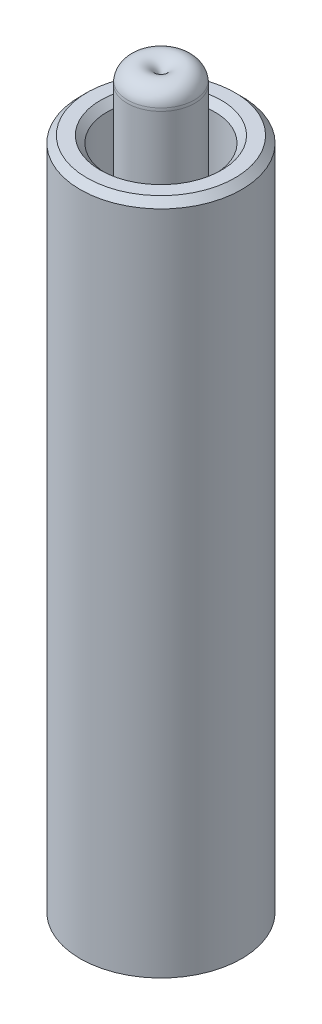
from build123d import *

# Parameters (mm, degrees)
SKETCH_1_R          = 6
EXTRUDE_1_DEPTH     = 50
SKETCH_2_R          = 4
SKETCH_2_R_2        = 2.5
CUT_EXTRUDE_1_DEPTH = 8
EXTRUDE_START       = 5
SKETCH_3_R          = 2.5
EXTRUDE_2_DEPTH     = 5
FILLET_1_R          = 1.7
SKETCH_4_R          = 0.096106959
CUT_EXTRUDE_2_DEPTH = 5
FILLET_2_R          = 1.2
CHAMFER_1_SIZE      = 0.5


with BuildPart() as part:
    # 草图1 → 凸台-拉伸1 (new body)
    with BuildSketch(Plane(origin=(0, 0, 0), x_dir=(1, 0, 0), z_dir=(0, 1, 0))):
        Circle(SKETCH_1_R)
    extrude(amount=EXTRUDE_1_DEPTH)

    # 草图2 → 切除-拉伸1 (cut)
    with BuildSketch(Plane(origin=(0, 50, 0), x_dir=(1, 0, 0), z_dir=(0, 1, 0))):
        Circle(SKETCH_2_R)
        Circle(SKETCH_2_R_2, mode=Mode.SUBTRACT)
    extrude(amount=-CUT_EXTRUDE_1_DEPTH, mode=Mode.SUBTRACT)

    # 草图3 → 凸台-拉伸2 (add)
    with BuildSketch(Plane(origin=(0, 50, 0), x_dir=(1, 0, 0), z_dir=(0, 1, 0)).offset(EXTRUDE_START)):
        Circle(SKETCH_3_R)
    extrude(amount=-EXTRUDE_2_DEPTH)

    # 圆角1
    fillet_1_edges = [part.edges().sort_by_distance(p)[0] for p in [
        (-2.5, 55, 0),
    ]]
    fillet(fillet_1_edges, radius=FILLET_1_R)

    # 草图4 → 切除-拉伸2 (cut)
    with BuildSketch(Plane(origin=(0, 55, 0), x_dir=(1, 0, 0), z_dir=(0, 1, 0))):
        Circle(SKETCH_4_R)
    extrude(amount=-CUT_EXTRUDE_2_DEPTH, mode=Mode.SUBTRACT)

    # 圆角2
    fillet_2_edges = [part.edges().sort_by_distance(p)[0] for p in [
        (-0.096106959, 55, 0),
    ]]
    fillet(fillet_2_edges, radius=FILLET_2_R)

    # 倒角1
    chamfer_1_edges = [part.edges().sort_by_distance(p)[0] for p in [
        (-6, 50, 0),
        (-4, 50, 0),
    ]]
    chamfer(chamfer_1_edges, length=CHAMFER_1_SIZE)


solid = part.part
